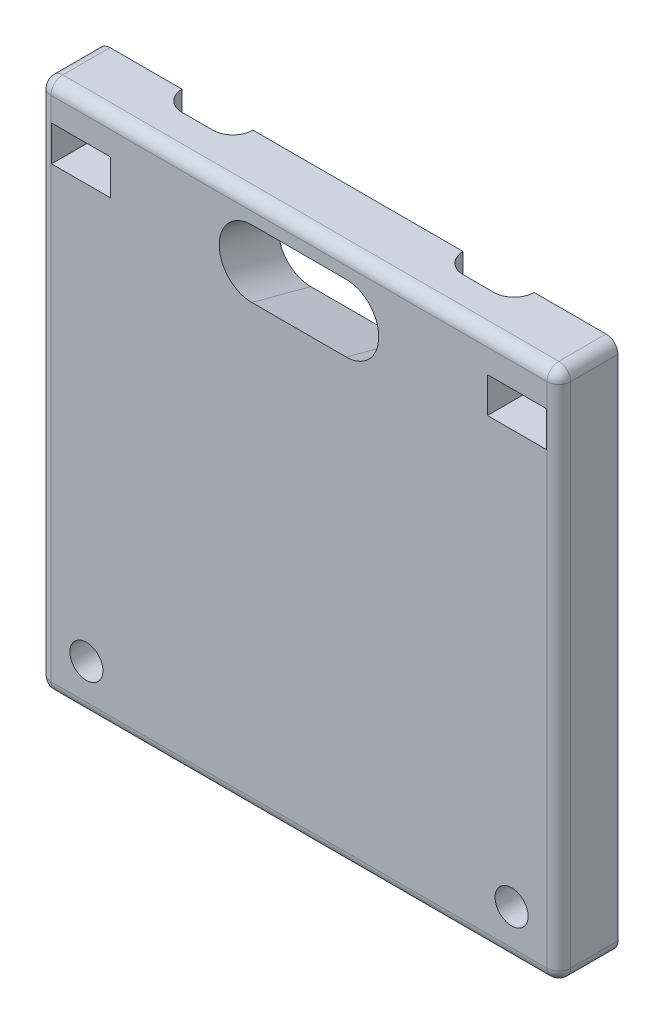
from build123d import *

# Parameters (mm, degrees)
SKETCH1_W                       = 44
SKETCH1_H                       = 45
BASE_DEPTH                      = 5
WIRE_GROOVES_DEPTH              = 51.338851795
SCREW_INSERTION_HOLE_DEPTH      = 33.181634738
SCREW_INSERTION_HOLE_DEPTH_BACK = 33.181634738
SKETCH5_W                       = 5
SKETCH5_H                       = 3
ZIP_TIE_SLOTS_DEPTH             = 32.862987933
SKETCH6_R                       = 1.4
MOUNT_CLAMPING_HOLES_DEPTH      = 32.862987933
EDGE_FILLETS_R                  = 1


with BuildPart() as part:
    # Sketch1 → Base (new body)
    with BuildSketch(Plane.XY):
        Rectangle(SKETCH1_W, SKETCH1_H)
    extrude(amount=BASE_DEPTH)

    # Sketch2 → Wire Grooves (cut, through all)
    with BuildSketch(Plane(origin=(0, 22.5, 0), x_dir=(1, 0, 0), z_dir=(0, 1, 0))):
        with BuildLine():
            Line((-14.9, 0), (-8.9, 0))
            ThreePointArc((-8.9, 0), (-9.397918472, -1.202081528), (-10.6, -1.7))
            Line((-10.6, -1.7), (-13.2, -1.7))
            ThreePointArc((-13.2, -1.7), (-14.402081528, -1.202081528), (-14.9, 0))
        make_face()
        with BuildLine():
            Line((13.2, -1.7), (10.6, -1.7))
            ThreePointArc((10.6, -1.7), (9.397918472, -1.202081528), (8.9, 0))
            Line((8.9, 0), (14.9, 0))
            ThreePointArc((14.9, 0), (14.402081528, -1.202081528), (13.2, -1.7))
        make_face()
    extrude(amount=-WIRE_GROOVES_DEPTH, mode=Mode.SUBTRACT)

    # Sketch3 → Screw Insertion Hole (cut, two sides: drawn at the far end of the back side and taken through both)
    with BuildSketch(Plane(origin=(0, 0.596130014, 4.269237963), x_dir=(-1, 0, 0), z_dir=(0, -0.25881904510252135, -0.9659258262890681)).offset(-SCREW_INSERTION_HOLE_DEPTH_BACK)):
        with BuildLine():
            Line((-4, 19.042473808), (4, 19.042473808))
            ThreePointArc((4, 19.042473808), (6.75, 16.292473808), (4, 13.542473808))
            Line((4, 13.542473808), (-4, 13.542473808))
            ThreePointArc((-4, 13.542473808), (-6.75, 16.292473808), (-4, 19.042473808))
        make_face()
    extrude(amount=SCREW_INSERTION_HOLE_DEPTH + SCREW_INSERTION_HOLE_DEPTH_BACK, mode=Mode.SUBTRACT)

    # Sketch5 → Zip Tie Slots (cut, through all)
    with BuildSketch(Plane(origin=(0, 0, 0), x_dir=(-1, 0, 0), z_dir=(0, 0, -1))):
        with Locations((-18.45, 18)):
            Rectangle(SKETCH5_W, SKETCH5_H)
        with Locations((18.45, 18)):
            Rectangle(SKETCH5_W, SKETCH5_H)
    extrude(amount=-ZIP_TIE_SLOTS_DEPTH, mode=Mode.SUBTRACT)

    # Sketch6 → Mount Clamping Holes (cut, through all)
    with BuildSketch(Plane(origin=(0, 0, 0), x_dir=(-1, 0, 0), z_dir=(0, 0, -1))):
        with Locations((-18, -18.5)):
            Circle(SKETCH6_R)
        with Locations((18, -18.5)):
            Circle(SKETCH6_R)
    extrude(amount=-MOUNT_CLAMPING_HOLES_DEPTH, mode=Mode.SUBTRACT)

    # Edge Fillets
    edge_fillets_edges = [part.edges().sort_by_distance(p)[0] for p in [
        (-22, 0, 5),
        (22, 0, 5),
        (0, -22.5, 5),
        (0, 22.5, 5),
        (22, 22.5, 2.5),
        (22, -22.5, 2.5),
        (-22, -22.5, 2.5),
        (-22, 22.5, 2.5),
    ]]
    fillet(edge_fillets_edges, radius=EDGE_FILLETS_R)


solid = part.part
